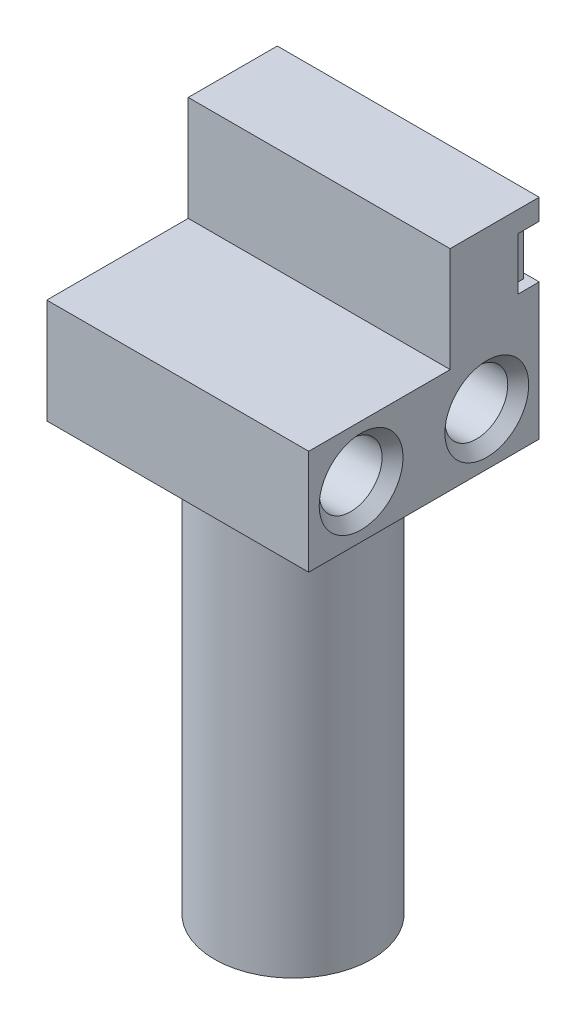
from build123d import *

# Parameters (mm, degrees)
SKETCH1_W           = 25
SKETCH1_H           = 22
BOSS_EXTRUDE1_DEPTH = 10
SKETCH2_R           = 3
CUT_EXTRUDE1_DEPTH  = 30.086079144
CHAMFER1_SIZE       = 1
SKETCH3_W           = 25
SKETCH3_H           = 8.5
BOSS_EXTRUDE2_DEPTH = 10
CUT_EXTRUDE2_DEPTH  = 5
SKETCH5_R           = 7.5
BOSS_EXTRUDE3_DEPTH = 40


with BuildPart() as part:
    # Sketch1 → Boss-Extrude1 (new body)
    with BuildSketch(Plane(origin=(0, 0, 0), x_dir=(1, 0, 0), z_dir=(0, 1, 0))):
        Rectangle(SKETCH1_W, SKETCH1_H)
    extrude(amount=BOSS_EXTRUDE1_DEPTH)

    # Sketch2 → Cut-Extrude1 (cut, through all)
    with BuildSketch(Plane(origin=(12.5, 0, 0), x_dir=(0, 0, -1), z_dir=(1, 0, 0))):
        with Locations((-6, 5)):
            Circle(SKETCH2_R)
        with Locations((6, 5)):
            Circle(SKETCH2_R)
    extrude(amount=-CUT_EXTRUDE1_DEPTH, mode=Mode.SUBTRACT)

    # Chamfer1
    chamfer1_edges = [part.edges().sort_by_distance(p)[0] for p in [
        (-12.5, 5, -3),
        (-12.5, 5, 9),
        (12.5, 5, -3),
        (12.5, 5, 9),
    ]]
    chamfer(chamfer1_edges, length=CHAMFER1_SIZE)

    # Sketch3 → Boss-Extrude2 (add)
    with BuildSketch(Plane(origin=(0, 10, 0), x_dir=(1, 0, 0), z_dir=(0, 1, 0))):
        with Locations((0, 6.75)):
            Rectangle(SKETCH3_W, SKETCH3_H)
    extrude(amount=BOSS_EXTRUDE2_DEPTH)

    # Sketch4 → Cut-Extrude2 (cut)
    with BuildSketch(Plane(origin=(0, 18, 0), x_dir=(1, 0, 0), z_dir=(0, 1, 0))):
        Polygon((12.5, 11), (-12.5, 11), (-12.5, 9), (-11.5, 9), (-11.5, 10.5), (-10.5, 10.5), (-10.5, 9), (-9.5, 9), (-9.5, 10.5), (-8.5, 10.5), (-8.5, 9), (-7.5, 9), (-7.5, 10.5), (-6.5, 10.5), (-6.5, 9), (-5.5, 9), (-5.5, 10.5), (-4.5, 10.5), (-4.5, 9), (-3.5, 9), (-3.5, 10.5), (-2.5, 10.5), (-2.5, 9), (-1.5, 9), (-1.5, 10.5), (-0.5, 10.5), (-0.5, 9), (0.5, 9), (0.5, 10.5), (1.5, 10.5), (1.5, 9), (2.5, 9), (2.5, 10.5), (3.5, 10.5), (3.5, 9), (4.5, 9), (4.5, 10.5), (5.5, 10.5), (5.5, 9), (6.5, 9), (6.5, 10.5), (7.5, 10.5), (7.5, 9), (8.5, 9), (8.5, 10.5), (9.5, 10.5), (9.5, 9), (10.5, 9), (10.5, 10.5), (11.5, 10.5), (11.5, 9), (12.5, 9), align=None)
    extrude(amount=-CUT_EXTRUDE2_DEPTH, mode=Mode.SUBTRACT)

    # Sketch5 → Boss-Extrude3 (add)
    with BuildSketch(Plane(origin=(0, 0, 0), x_dir=(-1, 0, 0), z_dir=(0, -1, 0))):
        Circle(SKETCH5_R)
    extrude(amount=BOSS_EXTRUDE3_DEPTH)


solid = part.part
